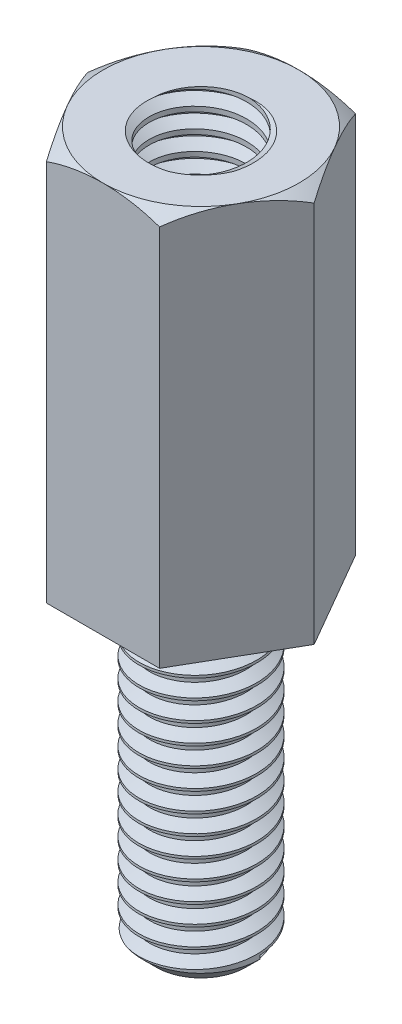
from build123d import *

# Parameters (mm, degrees)
BOSS_EXTRUDE1_DEPTH = 10
SKETCH3_R           = 1.25
CUT_EXTRUDE1_DEPTH  = 8
THREAD1_PITCH       = 0.5
SKETCH11_R          = 1.5
BOSS_EXTRUDE2_DEPTH = 8
THREAD2_PITCH       = 0.5


with BuildPart() as part:
    # Sketch2 → Boss-Extrude1 (new body)
    with BuildSketch(Plane(origin=(0, 0, 0), x_dir=(1, 0, 0), z_dir=(0, 1, 0))):
        Polygon((2.886751346, 0), (1.443375673, 2.5), (-1.443375673, 2.5), (-2.886751346, 0), (-1.443375673, -2.5), (1.443375673, -2.5), align=None)
    extrude(amount=BOSS_EXTRUDE1_DEPTH)

    # Sketch3 → Cut-Extrude1 (cut)
    with BuildSketch(Plane(origin=(0, 10, 0), x_dir=(1, 0, 0), z_dir=(0, 1, 0))):
        with Locations(Location((0, 0, 0), (0, 0, 270))):
            Circle(SKETCH3_R)
    extrude(amount=-CUT_EXTRUDE1_DEPTH, mode=Mode.SUBTRACT)

    # Thread1: the profile of Thread Profile1 profile screwed along a right-hand helix of 18 turns, 6 arcs to a turn; built about Z, then put on its axis
    thread1_z = Axis((0, 0, 0), (0, 0, 1))
    thread1_corners = [(1.2497, 0, -0.000173205), (1.520632938, 0, 0.156249999), (1.520632937, 0, 0.218749999), (1.2497, 0, 0.375173204)]
    with BuildLine(mode=Mode.PRIVATE) as thread1_profile:
        Line(thread1_corners[0], thread1_corners[1])
        Line(thread1_corners[1], thread1_corners[2])
        Line(thread1_corners[2], thread1_corners[3])
        Line(thread1_corners[3], thread1_corners[0])
    thread1_cap = Face(thread1_profile.wire())
    thread1_turn_angles = [0, 30, 60, 90, 120, 150, 180, 210, 240, 270, 300, 330, 360]
    thread1_turn_weights = [1, 0.8660254037844387, 1, 0.8660254037844387, 1, 0.8660254037844387, 1, 0.8660254037844387, 1, 0.8660254037844387, 1, 0.8660254037844387, 1]
    thread1_turn_rails = [Edge.make_bspline([Vector(p[0], p[1], 0).rotate(thread1_z, thread1_turn_angles[k]) / thread1_turn_weights[k] + Vector(0, 0, p[2] + THREAD1_PITCH * thread1_turn_angles[k] / 360) for k in range(13)], [0, 0, 0, 1, 1, 2, 2, 3, 3, 4, 4, 5, 5, 6, 6, 6], 2, thread1_turn_weights) for p in thread1_corners]
    thread1_turn_sides = [Face.make_surface_from_curves(thread1_turn_rails[p[0]], thread1_turn_rails[p[1]]) for p in [(0, 1), (1, 2), (2, 3), (3, 0)]]
    thread1 = Plane(origin=(0, 11, 0), x_dir=(-1, 0, 0), z_dir=(0, -1, 0)) * Solid(Shell([*[p.moved(Location((0, 0, THREAD1_PITCH * i))) for i in range(18) for p in thread1_turn_sides], thread1_cap, thread1_cap.rotate(thread1_z, 6480).moved(Location((0, 0, THREAD1_PITCH * 6480 / 360)))]))
    add(thread1, mode=Mode.SUBTRACT)

    # Sketch11 → Boss-Extrude2 (add)
    with BuildSketch(Plane(origin=(0, 0, 0), x_dir=(1, 0, 0), z_dir=(0, 1, 0))):
        with Locations(Location((0, 0, 0), (0, 0, 270))):
            Circle(SKETCH11_R)
    extrude(amount=-BOSS_EXTRUDE2_DEPTH)

    # Thread2: the profile of Thread Profile2 profile screwed along a right-hand helix of 15 turns, 6 arcs to a turn; built about Z, then put on its axis
    thread2_z = Axis((0, 0, 0), (0, 0, 1))
    thread2_corners = [(1.5003, 0, -0.000173205), (1.5003, 0, 0.437673204), (1.229367063, 0, 0.281249999), (1.229367063, 0, 0.156249999)]
    with BuildLine(mode=Mode.PRIVATE) as thread2_profile:
        Line(thread2_corners[0], thread2_corners[1])
        Line(thread2_corners[1], thread2_corners[2])
        Line(thread2_corners[2], thread2_corners[3])
        Line(thread2_corners[3], thread2_corners[0])
    thread2_cap = Face(thread2_profile.wire())
    thread2_turn_angles = [0, 30, 60, 90, 120, 150, 180, 210, 240, 270, 300, 330, 360]
    thread2_turn_weights = [1, 0.8660254037844387, 1, 0.8660254037844387, 1, 0.8660254037844387, 1, 0.8660254037844387, 1, 0.8660254037844387, 1, 0.8660254037844387, 1]
    thread2_turn_rails = [Edge.make_bspline([Vector(p[0], p[1], 0).rotate(thread2_z, thread2_turn_angles[k]) / thread2_turn_weights[k] + Vector(0, 0, p[2] + THREAD2_PITCH * thread2_turn_angles[k] / 360) for k in range(13)], [0, 0, 0, 1, 1, 2, 2, 3, 3, 4, 4, 5, 5, 6, 6, 6], 2, thread2_turn_weights) for p in thread2_corners]
    thread2_turn_sides = [Face.make_surface_from_curves(thread2_turn_rails[p[0]], thread2_turn_rails[p[1]]) for p in [(0, 1), (1, 2), (2, 3), (3, 0)]]
    thread2 = Plane(origin=(0, -8, 0), x_dir=(1, 0, 0), z_dir=(0, 1, 0)) * Solid(Shell([*[p.moved(Location((0, 0, THREAD2_PITCH * i))) for i in range(15) for p in thread2_turn_sides], thread2_cap, thread2_cap.rotate(thread2_z, 5400).moved(Location((0, 0, THREAD2_PITCH * 5400 / 360)))]))
    add(thread2, mode=Mode.SUBTRACT)

    # Sketch10 → Cut-Revolve1 (revolve, cut)
    with BuildSketch(Plane(origin=(0, 0, 0), x_dir=(0, 0, -1), z_dir=(1, 0, 0)), mode=Mode.PRIVATE) as cut_revolve1_sk:
        with BuildLine():
            Line((-3.5, 9.240587195), (-3.5, 10))
            Line((-3.5, 10), (-2.5, 10))
            ThreePointArc((-2.5, 10), (-3.023934019, 9.651810079), (-3.5, 9.240587195))
        make_face()
        Polygon((-2.15, -8), (-1.15, -8), (-2.15, -7), align=None)
        Polygon((-1.2, 0), (-4, 0), (-4, -3.3), (-1.2, -0.5), align=None)
    revolve(cut_revolve1_sk.sketch.rotate(Axis((0, -8.91028301, 0), (0, 1, 0)), 180), axis=Axis((0, -8.91028301, 0), (0, 1, 0)), mode=Mode.SUBTRACT)


solid = part.part
